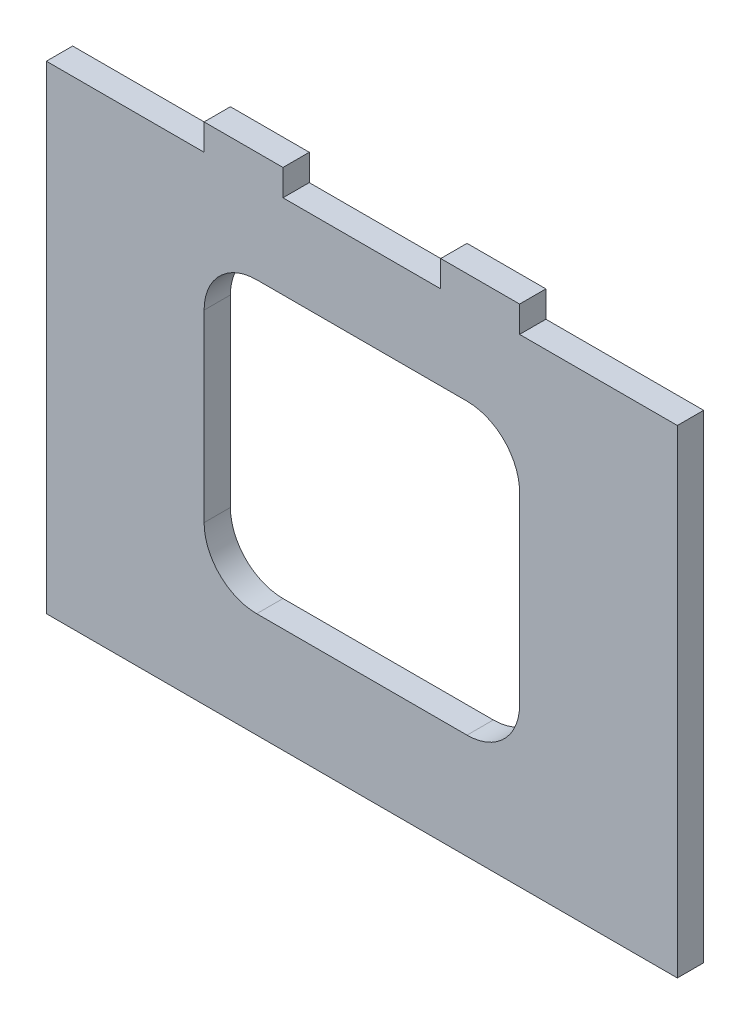
from build123d import *

# Parameters (mm, degrees)
SKIZZE1_W         = 120
SKIZZE1_H         = 91
GRUNDPLATTE_DEPTH = 5
SKIZZE2_W         = 60
SKIZZE2_H         = 55
DURCHBRUCH_DEPTH  = 151.685102117
VERRUNDUNG1_R     = 10
SKIZZE3_W         = 15
SKIZZE3_H         = 5
ZAPFEN_DEPTH      = 5


with BuildPart() as part:
    # Skizze1 → Grundplatte (new body)
    with BuildSketch(Plane.XY):
        with Locations((60, 45.5)):
            Rectangle(SKIZZE1_W, SKIZZE1_H)
    extrude(amount=GRUNDPLATTE_DEPTH)

    # Skizze2 → Durchbruch (cut, through all)
    with BuildSketch(Plane.XY.offset(5)):
        with Locations((60, 47.5)):
            Rectangle(SKIZZE2_W, SKIZZE2_H)
    extrude(amount=-DURCHBRUCH_DEPTH, mode=Mode.SUBTRACT)

    # Verrundung1
    verrundung1_edges = [part.edges().sort_by_distance(p)[0] for p in [
        (30, 20, 2.5),
        (90, 20, 2.5),
        (90, 75, 2.5),
        (30, 75, 2.5),
    ]]
    fillet(verrundung1_edges, radius=VERRUNDUNG1_R)

    # Skizze3 → Zapfen (add)
    with BuildSketch(Plane(origin=(0, 91, 0), x_dir=(1, 0, 0), z_dir=(0, 1, 0))):
        with Locations((82.5, -2.5)):
            Rectangle(SKIZZE3_W, SKIZZE3_H)
        with Locations((37.5, -2.5)):
            Rectangle(SKIZZE3_W, SKIZZE3_H)
    extrude(amount=ZAPFEN_DEPTH)


solid = part.part
